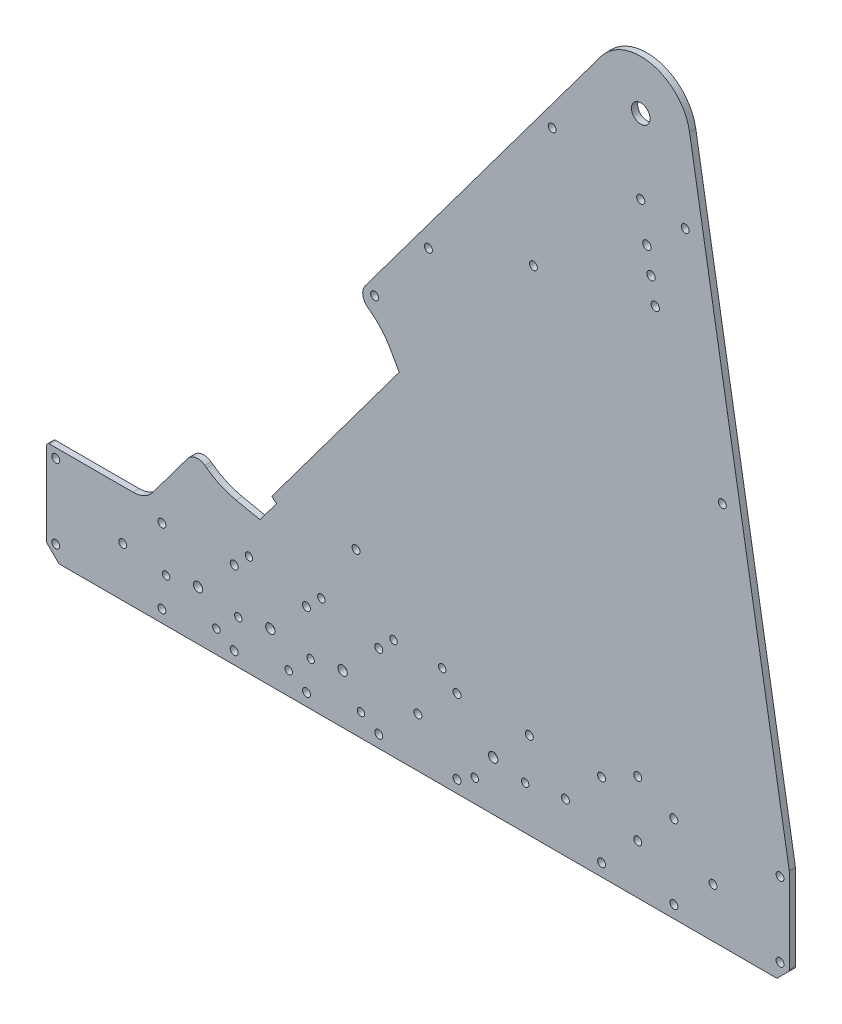
from build123d import *

# Parameters (mm, degrees)
BOSS_EXTRUDE1_DEPTH = 3.175
CUT_EXTRUDE1_REACH  = 536.354
SKETCH2_R           = 2.032
SKETCH5_R           = 2.032
SKETCH5_R_2         = 2.38125
CUT_EXTRUDE4_DEPTH  = 535.353537581
SKETCH6_R           = 2.032
CUT_EXTRUDE5_DEPTH  = 535.353537581
SKETCH3_R           = 4.7625
SKETCH3_R_2         = 2.032
SKETCH3_R_3         = 2.0955
SKETCH3_R_4         = 2.159
CUT_EXTRUDE2_DEPTH  = 535.353537581
FILLET1_R           = 1.5875
CUT_EXTRUDE3_REACH  = 536.354
SKETCH4_R           = 1.905
FILLET2_R           = 38.1
FILLET3_R           = 6.35


with BuildPart() as part:
    # Sketch1 → Boss-Extrude1 (new body)
    with BuildSketch(Plane.XY):
        with BuildLine():
            Line((0, 0), (381, 0))
            Line((381, 0), (381, 50.8))
            Line((381, 50.8), (329.844840527, 353.482725241))
            ThreePointArc((329.844840527, 353.482725241), (310.749161823, 373.943470262), (284.430621647, 364.423939024))
            Line((284.430621647, 364.423939024), (159.656664632, 196.928344436))
            Line((159.656664632, 196.928344436), (172.387526103, 187.444632546))
            Line((172.387526103, 187.444632546), (180.917147454, 172.321208422))
            Line((180.917147454, 172.321208422), (115.503856621, 84.510912876))
            Line((115.503856621, 84.510912876), (118.050028915, 82.614170498))
            Line((118.050028915, 82.614170498), (109.514688214, 71.156395174))
            Line((109.514688214, 71.156395174), (88.930861471, 75.413051604))
            Line((88.930861471, 75.413051604), (76.2, 84.896763494))
            Line((76.2, 84.896763494), (54.608894484, 55.913030488))
            ThreePointArc((54.608894484, 55.913030488), (50.122252657, 52.150010731), (44.424205307, 50.8))
            Line((44.424205307, 50.8), (0, 50.8))
            Line((0, 50.8), (0, 0))
        make_face()
    extrude(amount=BOSS_EXTRUDE1_DEPTH)

    # Sketch2 → Cut-Extrude1 (cut, up to next)
    with BuildSketch(Plane.XY.offset(3.175), mode=Mode.PRIVATE) as cut_extrude1_sk1:
        with Locations((4.7625, 46.0375)):
            Circle(SKETCH2_R)
    cut_extrude1_tool1 = extrude(cut_extrude1_sk1.sketch, amount=-CUT_EXTRUDE1_REACH, mode=Mode.PRIVATE) & part.part
    # Sketch2 → Cut-Extrude1 (cut, up to next)
    with BuildSketch(Plane.XY.offset(3.175), mode=Mode.PRIVATE) as cut_extrude1_sk2:
        with Locations((4.7625, 7.9375)):
            Circle(SKETCH2_R)
    cut_extrude1_tool2 = extrude(cut_extrude1_sk2.sketch, amount=-CUT_EXTRUDE1_REACH, mode=Mode.PRIVATE) & part.part
    # Sketch2 → Cut-Extrude1 (cut, up to next)
    with BuildSketch(Plane.XY.offset(3.175), mode=Mode.PRIVATE) as cut_extrude1_sk3:
        with Locations((376.2375, 7.9375)):
            Circle(SKETCH2_R)
    cut_extrude1_tool3 = extrude(cut_extrude1_sk3.sketch, amount=-CUT_EXTRUDE1_REACH, mode=Mode.PRIVATE) & part.part
    # Sketch2 → Cut-Extrude1 (cut, up to next)
    with BuildSketch(Plane.XY.offset(3.175), mode=Mode.PRIVATE) as cut_extrude1_sk4:
        with Locations((376.2375, 46.0375)):
            Circle(SKETCH2_R)
    cut_extrude1_tool4 = extrude(cut_extrude1_sk4.sketch, amount=-CUT_EXTRUDE1_REACH, mode=Mode.PRIVATE) & part.part
    # Sketch2 → Cut-Extrude1 (cut, up to next)
    with BuildSketch(Plane.XY.offset(3.175), mode=Mode.PRIVATE) as cut_extrude1_sk5:
        Polygon((0, 6.35), (0, 0), (6.35, 0), align=None)
    cut_extrude1_tool5 = extrude(cut_extrude1_sk5.sketch, amount=-CUT_EXTRUDE1_REACH, mode=Mode.PRIVATE) & part.part
    # Sketch2 → Cut-Extrude1 (cut, up to next)
    with BuildSketch(Plane.XY.offset(3.175), mode=Mode.PRIVATE) as cut_extrude1_sk6:
        Polygon((381, 0), (374.65, 0), (381, 6.35), align=None)
    cut_extrude1_tool6 = extrude(cut_extrude1_sk6.sketch, amount=-CUT_EXTRUDE1_REACH, mode=Mode.PRIVATE) & part.part
    add(cut_extrude1_tool1.solids().sort_by_distance((4.7625, 46.0375, 3.175))[0], mode=Mode.SUBTRACT)
    add(cut_extrude1_tool2.solids().sort_by_distance((4.7625, 7.9375, 3.175))[0], mode=Mode.SUBTRACT)
    add(cut_extrude1_tool3.solids().sort_by_distance((376.2375, 7.9375, 3.175))[0], mode=Mode.SUBTRACT)
    add(cut_extrude1_tool4.solids().sort_by_distance((376.2375, 46.0375, 3.175))[0], mode=Mode.SUBTRACT)
    add(cut_extrude1_tool5.solids().sort_by_distance((2.116667, 2.116667, 3.175))[0], mode=Mode.SUBTRACT)
    add(cut_extrude1_tool6.solids().sort_by_distance((378.883333, 2.116667, 3.175))[0], mode=Mode.SUBTRACT)

    # Sketch5 → Cut-Extrude4 (cut, through all)
    with BuildSketch(Plane.XY.offset(3.175)):
        with Locations((39.116, 25.4)):
            Circle(SKETCH5_R)
        with Locations((59.182, 6.35)):
            Circle(SKETCH5_R)
        with Locations((59.182, 44.45)):
            Circle(SKETCH5_R)
        with Locations((96.266, 44.45)):
            Circle(SKETCH5_R)
        with Locations((133.35, 44.45)):
            Circle(SKETCH5_R)
        with Locations((170.434, 44.45)):
            Circle(SKETCH5_R)
        with Locations((210.566, 44.45)):
            Circle(SKETCH5_R)
        with Locations((210.566, 6.35)):
            Circle(SKETCH5_R)
        with Locations((170.434, 6.35)):
            Circle(SKETCH5_R)
        with Locations((247.65, 44.45)):
            Circle(SKETCH5_R)
        with Locations((266.192, 25.4)):
            Circle(SKETCH5_R)
        with Locations((77.724, 25.4)):
            Circle(SKETCH5_R_2)
        with Locations((114.808, 25.4)):
            Circle(SKETCH5_R_2)
        with Locations((151.892, 25.4)):
            Circle(SKETCH5_R_2)
        with Locations((229.108, 25.4)):
            Circle(SKETCH5_R_2)
        with Locations((190.5, 25.4)):
            Circle(SKETCH5_R)
        with Locations((303.276, 25.4)):
            Circle(SKETCH5_R)
        with Locations((341.884, 25.4)):
            Circle(SKETCH5_R)
    extrude(amount=-CUT_EXTRUDE4_DEPTH, mode=Mode.SUBTRACT)

    # Sketch6 → Cut-Extrude5 (cut, through all)
    with BuildSketch(Plane.XY.offset(3.175)):
        with Locations((284.734, 44.45)):
            Circle(SKETCH6_R)
        with Locations((284.734, 6.35)):
            Circle(SKETCH6_R)
        with Locations((321.818, 6.35)):
            Circle(SKETCH6_R)
        with Locations((321.818, 44.45)):
            Circle(SKETCH6_R)
        with Locations((96.266, 6.35)):
            Circle(SKETCH6_R)
        with Locations((133.35, 6.35)):
            Circle(SKETCH6_R)
        with Locations((303.276, 53.975)):
            Circle(SKETCH6_R)
    extrude(amount=-CUT_EXTRUDE5_DEPTH, mode=Mode.SUBTRACT)

    # Sketch3 → Cut-Extrude2 (cut, through all)
    with BuildSketch(Plane.XY.offset(3.175)):
        with Locations((304.8, 349.25)):
            Circle(SKETCH3_R)
        with Locations((168.275, 200.025)):
            Circle(SKETCH3_R_2)
        with Locations((158.75, 82.55)):
            Circle(SKETCH3_R_2)
        with Locations((304.8, 311.15)):
            Circle(SKETCH3_R_3)
        with Locations((307.974543931, 292.366369605)):
            Circle(SKETCH3_R_4)
        with Locations((310.090906551, 279.843949341)):
            Circle(SKETCH3_R_4)
        with Locations((312.207269172, 267.321529077)):
            Circle(SKETCH3_R_4)
        with Locations((327.609354572, 309.551782373)):
            Circle(SKETCH3_R_2)
        with Locations((346.656618156, 196.85)):
            Circle(SKETCH3_R_2)
        with Locations((195.89872712, 234.95)):
            Circle(SKETCH3_R_2)
        with Locations((249.748290579, 254.09019371)):
            Circle(SKETCH3_R_2)
        with Locations((259.353431816, 320.131104669)):
            Circle(SKETCH3_R_2)
    extrude(amount=-CUT_EXTRUDE2_DEPTH, mode=Mode.SUBTRACT)

    # Fillet1
    fillet1_edges = [part.edges().sort_by_distance(p)[0] for p in [
        (374.65, 0, 1.5875),
        (381, 6.35, 1.5875),
        (381, 50.8, 1.5875),
        (6.35, 0, 1.5875),
        (0, 6.35, 1.5875),
        (0, 50.8, 1.5875),
    ]]
    fillet(fillet1_edges, radius=FILLET1_R)

    # Sketch4 → Cut-Extrude3 (cut, up to next)
    with BuildSketch(Plane(origin=(0, 0, 0), x_dir=(-1, 0, 0), z_dir=(0, 0, -1)), mode=Mode.PRIVATE) as cut_extrude3_sk1:
        with Locations((-61.318145625, 22.298133105)):
            Circle(SKETCH4_R)
    cut_extrude3_tool1 = extrude(cut_extrude3_sk1.sketch, amount=-CUT_EXTRUDE3_REACH, mode=Mode.PRIVATE) & part.part
    # Sketch4 → Cut-Extrude3 (cut, up to next)
    with BuildSketch(Plane(origin=(0, 0, 0), x_dir=(-1, 0, 0), z_dir=(0, 0, -1)), mode=Mode.PRIVATE) as cut_extrude3_sk2:
        with Locations((-87.131339764, 11.605958005)):
            Circle(SKETCH4_R)
    cut_extrude3_tool2 = extrude(cut_extrude3_sk2.sketch, amount=-CUT_EXTRUDE3_REACH, mode=Mode.PRIVATE) & part.part
    # Sketch4 → Cut-Extrude3 (cut, up to next)
    with BuildSketch(Plane(origin=(0, 0, 0), x_dir=(-1, 0, 0), z_dir=(0, 0, -1)), mode=Mode.PRIVATE) as cut_extrude3_sk3:
        with Locations((-98.402145625, 22.298133105)):
            Circle(SKETCH4_R)
    cut_extrude3_tool3 = extrude(cut_extrude3_sk3.sketch, amount=-CUT_EXTRUDE3_REACH, mode=Mode.PRIVATE) & part.part
    # Sketch4 → Cut-Extrude3 (cut, up to next)
    with BuildSketch(Plane(origin=(0, 0, 0), x_dir=(-1, 0, 0), z_dir=(0, 0, -1)), mode=Mode.PRIVATE) as cut_extrude3_sk4:
        with Locations((-124.215339764, 11.605958005)):
            Circle(SKETCH4_R)
    cut_extrude3_tool4 = extrude(cut_extrude3_sk4.sketch, amount=-CUT_EXTRUDE3_REACH, mode=Mode.PRIVATE) & part.part
    # Sketch4 → Cut-Extrude3 (cut, up to next)
    with BuildSketch(Plane(origin=(0, 0, 0), x_dir=(-1, 0, 0), z_dir=(0, 0, -1)), mode=Mode.PRIVATE) as cut_extrude3_sk5:
        with Locations((-135.486145625, 22.298133105)):
            Circle(SKETCH4_R)
    cut_extrude3_tool5 = extrude(cut_extrude3_sk5.sketch, amount=-CUT_EXTRUDE3_REACH, mode=Mode.PRIVATE) & part.part
    # Sketch4 → Cut-Extrude3 (cut, up to next)
    with BuildSketch(Plane(origin=(0, 0, 0), x_dir=(-1, 0, 0), z_dir=(0, 0, -1)), mode=Mode.PRIVATE) as cut_extrude3_sk6:
        with Locations((-161.299339764, 11.605958005)):
            Circle(SKETCH4_R)
    cut_extrude3_tool6 = extrude(cut_extrude3_sk6.sketch, amount=-CUT_EXTRUDE3_REACH, mode=Mode.PRIVATE) & part.part
    # Sketch4 → Cut-Extrude3 (cut, up to next)
    with BuildSketch(Plane(origin=(0, 0, 0), x_dir=(-1, 0, 0), z_dir=(0, 0, -1)), mode=Mode.PRIVATE) as cut_extrude3_sk7:
        with Locations((-245.513854375, 22.298133105)):
            Circle(SKETCH4_R)
    cut_extrude3_tool7 = extrude(cut_extrude3_sk7.sketch, amount=-CUT_EXTRUDE3_REACH, mode=Mode.PRIVATE) & part.part
    # Sketch4 → Cut-Extrude3 (cut, up to next)
    with BuildSketch(Plane(origin=(0, 0, 0), x_dir=(-1, 0, 0), z_dir=(0, 0, -1)), mode=Mode.PRIVATE) as cut_extrude3_sk8:
        with Locations((-219.700660236, 11.605958005)):
            Circle(SKETCH4_R)
    cut_extrude3_tool8 = extrude(cut_extrude3_sk8.sketch, amount=-CUT_EXTRUDE3_REACH, mode=Mode.PRIVATE) & part.part
    # Sketch4 → Cut-Extrude3 (cut, up to next)
    with BuildSketch(Plane(origin=(0, 0, 0), x_dir=(-1, 0, 0), z_dir=(0, 0, -1)), mode=Mode.PRIVATE) as cut_extrude3_sk9:
        with Locations((-202.981986443, 51.968407021)):
            Circle(SKETCH4_R)
    cut_extrude3_tool9 = extrude(cut_extrude3_sk9.sketch, amount=-CUT_EXTRUDE3_REACH, mode=Mode.PRIVATE) & part.part
    # Sketch4 → Cut-Extrude3 (cut, up to next)
    with BuildSketch(Plane(origin=(0, 0, 0), x_dir=(-1, 0, 0), z_dir=(0, 0, -1)), mode=Mode.PRIVATE) as cut_extrude3_sk10:
        with Locations((-178.018013557, 51.968407021)):
            Circle(SKETCH4_R)
    cut_extrude3_tool10 = extrude(cut_extrude3_sk10.sketch, amount=-CUT_EXTRUDE3_REACH, mode=Mode.PRIVATE) & part.part
    # Sketch4 → Cut-Extrude3 (cut, up to next)
    with BuildSketch(Plane(origin=(0, 0, 0), x_dir=(-1, 0, 0), z_dir=(0, 0, -1)), mode=Mode.PRIVATE) as cut_extrude3_sk11:
        with Locations((-140.934013557, 51.968407021)):
            Circle(SKETCH4_R)
    cut_extrude3_tool11 = extrude(cut_extrude3_sk11.sketch, amount=-CUT_EXTRUDE3_REACH, mode=Mode.PRIVATE) & part.part
    # Sketch4 → Cut-Extrude3 (cut, up to next)
    with BuildSketch(Plane(origin=(0, 0, 0), x_dir=(-1, 0, 0), z_dir=(0, 0, -1)), mode=Mode.PRIVATE) as cut_extrude3_sk12:
        with Locations((-103.850013557, 51.968407021)):
            Circle(SKETCH4_R)
    cut_extrude3_tool12 = extrude(cut_extrude3_sk12.sketch, amount=-CUT_EXTRUDE3_REACH, mode=Mode.PRIVATE) & part.part
    add(cut_extrude3_tool1.solids().sort_by_distance((61.318146, 22.298133, 0))[0], mode=Mode.SUBTRACT)
    add(cut_extrude3_tool2.solids().sort_by_distance((87.13134, 11.605958, 0))[0], mode=Mode.SUBTRACT)
    add(cut_extrude3_tool3.solids().sort_by_distance((98.402146, 22.298133, 0))[0], mode=Mode.SUBTRACT)
    add(cut_extrude3_tool4.solids().sort_by_distance((124.21534, 11.605958, 0))[0], mode=Mode.SUBTRACT)
    add(cut_extrude3_tool5.solids().sort_by_distance((135.486146, 22.298133, 0))[0], mode=Mode.SUBTRACT)
    add(cut_extrude3_tool6.solids().sort_by_distance((161.29934, 11.605958, 0))[0], mode=Mode.SUBTRACT)
    add(cut_extrude3_tool7.solids().sort_by_distance((245.513854, 22.298133, 0))[0], mode=Mode.SUBTRACT)
    add(cut_extrude3_tool8.solids().sort_by_distance((219.70066, 11.605958, 0))[0], mode=Mode.SUBTRACT)
    add(cut_extrude3_tool9.solids().sort_by_distance((202.981986, 51.968407, 0))[0], mode=Mode.SUBTRACT)
    add(cut_extrude3_tool10.solids().sort_by_distance((178.018014, 51.968407, 0))[0], mode=Mode.SUBTRACT)
    add(cut_extrude3_tool11.solids().sort_by_distance((140.934014, 51.968407, 0))[0], mode=Mode.SUBTRACT)
    add(cut_extrude3_tool12.solids().sort_by_distance((103.850014, 51.968407, 0))[0], mode=Mode.SUBTRACT)

    # Fillet2
    fillet2_edges = [part.edges().sort_by_distance(p)[0] for p in [
        (88.930861471, 75.413051604, 1.5875),
        (172.387526103, 187.444632546, 1.5875),
    ]]
    fillet(fillet2_edges, radius=FILLET2_R)

    # Fillet3
    fillet3_edges = [part.edges().sort_by_distance(p)[0] for p in [
        (76.2, 84.896763494, 1.5875),
        (159.656664632, 196.928344436, 1.5875),
    ]]
    fillet(fillet3_edges, radius=FILLET3_R)


solid = part.part
